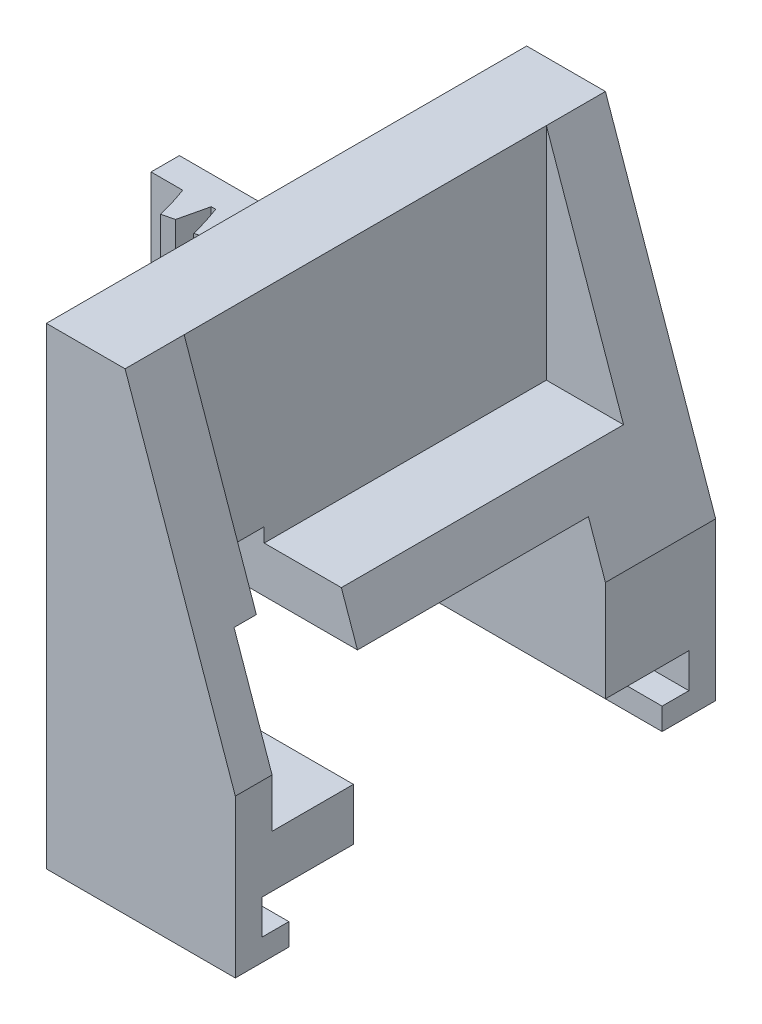
from build123d import *

# Parameters (mm, degrees)
BOSS_EXTRUDE1_DEPTH = 30.5
SKETCH4_W           = 16
SKETCH4_H           = 14
CUT_EXTRUDE2_DEPTH  = 25
CUT_EXTRUDE4_DEPTH  = 11.5
BOSS_EXTRUDE2_DEPTH = 8
SKETCH8_W           = 6.5
SKETCH8_H           = 10
CUT_EXTRUDE5_DEPTH  = 47.810789355
CUT_EXTRUDE6_DEPTH  = 47.810789355


with BuildPart() as part:
    # Sketch1 → Boss-Extrude1 (new body)
    with BuildSketch(Plane.XY):
        Polygon((0, 0), (0, -30), (12, -30), (12, -20), (5, 0), align=None)
    extrude(amount=-BOSS_EXTRUDE1_DEPTH)

    # Sketch4 → Cut-Extrude2 (cut)
    with BuildSketch(Plane.ZY):
        with Locations((-15.5, -23.917856259)):
            Rectangle(SKETCH4_W, SKETCH4_H)
    extrude(amount=-CUT_EXTRUDE2_DEPTH, mode=Mode.SUBTRACT)

    # Sketch6 → Cut-Extrude4 (cut, symmetric)
    with BuildSketch(Plane.XY.offset(-15.25)):
        Polygon((5, 0), (5, -14), (9.9, -14), align=None)
    extrude(amount=CUT_EXTRUDE4_DEPTH, both=True, mode=Mode.SUBTRACT)

    # Sketch7 → Boss-Extrude2 (add)
    with BuildSketch(Plane(origin=(0, -22, 0), x_dir=(1, 0, 0), z_dir=(0, 1, 0))):
        with BuildLine():
            Line((0, 27.45), (-19, 27.45))
            Line((-19, 27.45), (-19, 25.65))
            Line((-19, 25.65), (-16.993455994, 25.65))
            ThreePointArc((-16.993455994, 25.65), (-16.650158075, 24.647892846), (-16.365476207, 23.627584833))
            Line((-16.365476207, 23.627584833), (-15.609396851, 23.815112691))
            Line((-15.609396851, 23.815112691), (-15.179008189, 25.65))
            Line((-15.179008189, 25.65), (-14.896454824, 25.65))
            ThreePointArc((-14.896454824, 25.65), (-14.553156905, 24.647892846), (-14.268475038, 23.627584833))
            Line((-14.268475038, 23.627584833), (-13.512395681, 23.815112691))
            Line((-13.512395681, 23.815112691), (-13.082007019, 25.65))
            Line((-13.082007019, 25.65), (-12.799453654, 25.65))
            ThreePointArc((-12.799453654, 25.65), (-12.456155735, 24.647892846), (-12.171473868, 23.627584833))
            Line((-12.171473868, 23.627584833), (-11.415394512, 23.815112691))
            Line((-11.415394512, 23.815112691), (-10.985005849, 25.65))
            Line((-10.985005849, 25.65), (-10.702452484, 25.65))
            ThreePointArc((-10.702452484, 25.65), (-10.359154566, 24.647892846), (-10.074472698, 23.627584833))
            Line((-10.074472698, 23.627584833), (-9.318393342, 23.815112691))
            Line((-9.318393342, 23.815112691), (-8.888004679, 25.65))
            Line((-8.888004679, 25.65), (-8.605451315, 25.65))
            ThreePointArc((-8.605451315, 25.65), (-8.262153396, 24.647892846), (-7.977471528, 23.627584833))
            Line((-7.977471528, 23.627584833), (-7.221392172, 23.815112691))
            Line((-7.221392172, 23.815112691), (-6.791003509, 25.65))
            Line((-6.791003509, 25.65), (-6.508450145, 25.65))
            ThreePointArc((-6.508450145, 25.65), (-6.165152226, 24.647892846), (-5.880470358, 23.627584833))
            Line((-5.880470358, 23.627584833), (-5.124391002, 23.815112691))
            Line((-5.124391002, 23.815112691), (-4.69400234, 25.65))
            Line((-4.69400234, 25.65), (-4.411448975, 25.65))
            ThreePointArc((-4.411448975, 25.65), (-4.068151056, 24.647892846), (-3.783469189, 23.627584833))
            Line((-3.783469189, 23.627584833), (-3.027389832, 23.815112691))
            Line((-3.027389832, 23.815112691), (-2.59700117, 25.65))
            Line((-2.59700117, 25.65), (-2.314447805, 25.65))
            ThreePointArc((-2.314447805, 25.65), (-1.971149886, 24.647892846), (-1.686468019, 23.627584833))
            Line((-1.686468019, 23.627584833), (-0.930388662, 23.815112691))
            Line((-0.930388662, 23.815112691), (-0.5, 25.65))
            Line((-0.5, 25.65), (0, 25.65))
            Line((0, 25.65), (0, 27.45))
        make_face()
    extrude(amount=BOSS_EXTRUDE2_DEPTH)

    # Sketch8 → Cut-Extrude5 (cut, through all)
    with BuildSketch(Plane.ZY):
        with Locations((-5.583766481, -18.1)):
            Rectangle(SKETCH8_W, SKETCH8_H)
    extrude(amount=-CUT_EXTRUDE5_DEPTH, mode=Mode.SUBTRACT)

    # Sketch9 → Cut-Extrude6 (cut, through all)
    with BuildSketch(Plane.ZY):
        Polygon((-7.5, -26.4), (-1.7, -26.4), (-1.7, -28.6), (-3.4, -28.6), (-3.4, -30.296685761), (-7.5, -30.296685761), align=None)
        Polygon((-23, -30.296685761), (-23, -26.4), (-28.8, -26.4), (-28.8, -28.6), (-27.1, -28.6), (-27.1, -30.296685761), align=None)
    extrude(amount=-CUT_EXTRUDE6_DEPTH, mode=Mode.SUBTRACT)


solid = part.part
